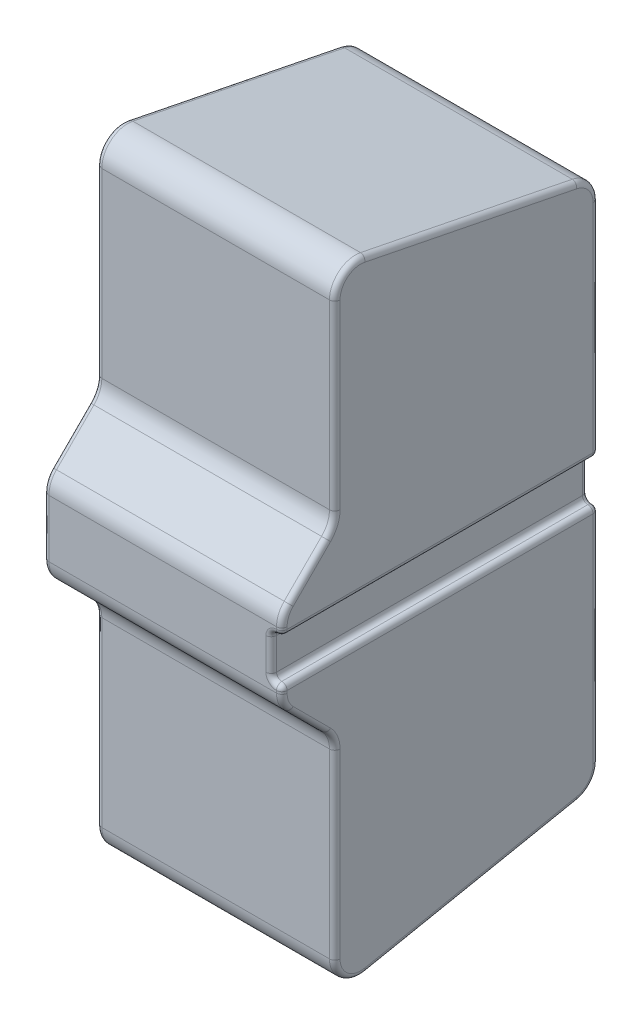
from build123d import *

# Parameters (mm, degrees)
BOSS_EXTRUDE2_START      = -3
BOSS_EXTRUDE2_DEPTH      = 4.5
BOSS_EXTRUDE3_DEPTH      = 1.3
BOSS_EXTRUDE3_DEPTH_BACK = 3
SKETCH2_3_W              = 0.8
SKETCH2_3_H              = 5.98
FILLET1_R                = 0.1


with BuildPart() as part:
    # Sketch2 → Boss-Extrude2 (new body)
    with BuildSketch(Plane.YZ.offset(BOSS_EXTRUDE2_START)):
        with BuildLine():
            Line((-0.4, -3.49), (-0.4, 2.49))
            Line((-0.4, 2.49), (-0.542893219, 2.49))
            ThreePointArc((-0.542893219, 2.49), (-0.730408101, 2.452700971), (-0.889375542, 2.346482323))
            Line((-0.889375542, 2.346482323), (-1.596482323, 1.639375542))
            ThreePointArc((-1.596482323, 1.639375542), (-1.761938231, 1.528821438), (-1.957106781, 1.49))
            Line((-1.957106781, 1.49), (-5.390098049, 1.49))
            ThreePointArc((-5.390098049, 1.49), (-5.769035698, 1.310654564), (-5.87058258, 0.903903094))
            Line((-5.87058258, 0.903903094), (-5.07058258, -3.096096906))
            ThreePointArc((-5.07058258, -3.096096906), (-4.900752612, -3.378937649), (-4.590098049, -3.49))
            Line((-4.590098049, -3.49), (-0.4, -3.49))
        make_face()
    boss_extrude2 = extrude(amount=BOSS_EXTRUDE2_DEPTH)

    # Sketch2<3> → Boss-Extrude3 (add, two sides: drawn at the far end of the back side and taken through both)
    with BuildSketch(Plane.YZ.offset(-BOSS_EXTRUDE3_DEPTH_BACK)):
        with Locations((0, -0.5)):
            Rectangle(SKETCH2_3_W, SKETCH2_3_H)
    extrude(amount=BOSS_EXTRUDE3_DEPTH + BOSS_EXTRUDE3_DEPTH_BACK)

    # Mirror1: Boss-Extrude2 across plane
    add(boss_extrude2.mirror(Plane.ZX))

    # Fillet1
    fillet1_edges = [part.edges().sort_by_distance(p)[0] for p in [
        (1.3, -0.4, -0.5),
        (1.3, 0.4, -0.5),
    ]]
    fillet(fillet1_edges, radius=FILLET1_R)
    fillet1_2_edges = [part.edges().sort_by_distance(p)[0] for p in [
        (1.3, 0, -3.49),
        (1.3, 0, 2.49),
        (1.5, 5.769035698, 1.310654564),
        (1.5, 5.47058258, -1.096096906),
        (1.5, 4.900752612, -3.378937649),
        (1.5, 2.495049024, -3.49),
        (1.5, 0.4, -0.5),
        (1.5, 0.471446609, 2.49),
        (1.5, 0.730408101, 2.452700971),
        (1.5, 1.242928932, 1.992928932),
        (1.5, 1.761938231, 1.528821438),
        (1.5, 3.673602415, 1.49),
        (1.5, -1.761938231, 1.528821438),
        (1.5, -1.242928932, 1.992928932),
        (1.5, -0.730408101, 2.452700971),
        (1.5, -0.471446609, 2.49),
        (1.5, -0.4, -0.5),
        (1.5, -2.495049024, -3.49),
        (1.5, -4.900752612, -3.378937649),
        (1.5, -5.47058258, -1.096096906),
        (1.5, -5.769035698, 1.310654564),
        (1.5, -3.673602415, 1.49),
        (-3, -5.769035698, 1.310654564),
        (-3, -5.47058258, -1.096096906),
        (-3, -4.900752612, -3.378937649),
        (-3, 0, -3.49),
        (-3, 4.900752612, -3.378937649),
        (-3, 5.47058258, -1.096096906),
        (-3, 5.769035698, 1.310654564),
        (-3, 3.673602415, 1.49),
        (-3, 1.761938231, 1.528821438),
        (-3, 1.242928932, 1.992928932),
        (-3, 0.730408101, 2.452700971),
        (-3, 0, 2.49),
        (-3, -0.730408101, 2.452700971),
        (-3, -1.242928932, 1.992928932),
        (-3, -1.761938231, 1.528821438),
        (-3, -3.673602415, 1.49),
        (1.329289322, 0.370710678, 2.49),
        (1.329289322, -0.370710678, 2.49),
        (1.329289322, -0.370710678, -3.49),
        (1.329289322, 0.370710678, -3.49),
    ]]
    fillet(fillet1_2_edges, radius=FILLET1_R - 0.0001)  # a hair under: the kernel refuses the full size


solid = part.part
